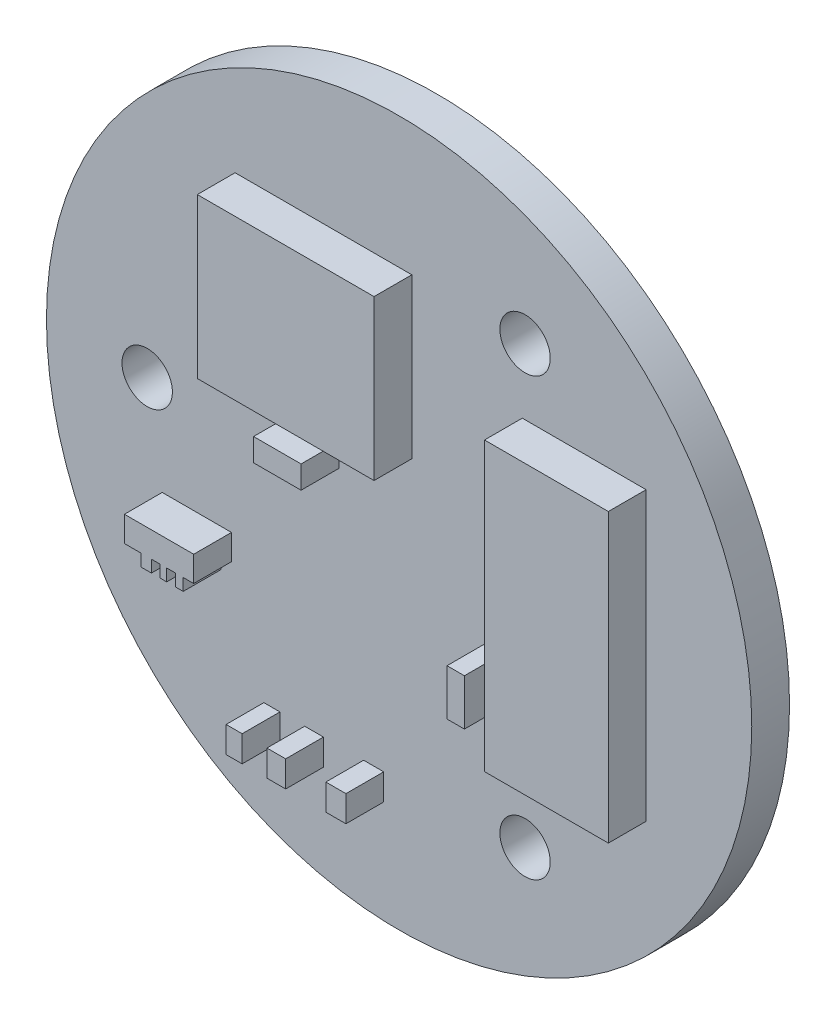
from build123d import *

# Parameters (mm, degrees)
SKETCH_1_R          = 14
EXTRUDE_1_DEPTH     = 1.5
SKETCH_2_W          = 4
SKETCH_2_H          = 5
EXTRUDE_2_DEPTH     = 1.8
SKETCH_3_R          = 1
CUT_EXTRUDE_1_DEPTH = 1.8
SKETCH_4_W          = 7.015976939
SKETCH_4_H          = 6.325009514
SKETCH_4_W_2        = 4.916498991
SKETCH_4_H_2        = 11.400962527
SKETCH_4_W_3        = 1.886872586
SKETCH_4_H_3        = 0.903572787
SKETCH_4_W_4        = 0.637816086
SKETCH_4_H_4        = 1.036451139
SKETCH_4_W_5        = 0.744118766
SKETCH_4_W_6        = 0.797270107
SKETCH_4_W_7        = 0.690967426
SKETCH_4_H_5        = 1.833721246
EXTRUDE_3_DEPTH     = 1.5


with BuildPart() as part:
    # 草图1 → 凸台-拉伸1 (new body)
    with BuildSketch(Plane.XY):
        Circle(SKETCH_1_R)
    extrude(amount=EXTRUDE_1_DEPTH)

    # 草图2 → 凸台-拉伸2 (add)
    with BuildSketch(Plane(origin=(0, 0, 0), x_dir=(-1, 0, 0), z_dir=(0, 0, -1))):
        Rectangle(SKETCH_2_W, SKETCH_2_H)
    extrude(amount=EXTRUDE_2_DEPTH)

    # 草图3 → 切除-拉伸1 (cut)
    with BuildSketch(Plane(origin=(0, 0, 0), x_dir=(-1, 0, 0), z_dir=(0, 0, -1))):
        with Locations((10, 0)):
            Circle(SKETCH_3_R)
        with Locations((-5, 8.660254038)):
            Circle(SKETCH_3_R)
        with Locations((-5, -8.660254038)):
            Circle(SKETCH_3_R)
    extrude(amount=-CUT_EXTRUDE_1_DEPTH, mode=Mode.SUBTRACT)

    # 草图4 → 凸台-拉伸3 (add)
    with BuildSketch(Plane.XY.offset(1.5)):
        Polygon((-8.105579419, -3.654154656), (-6.654300112, -3.654154656), (-6.654300112, -4.661389837), (-7.070508219, -4.661389837), (-7.070508219, -5.140659778), (-7.379939766, -5.140659778), (-7.379939766, -4.661389837), (-7.726351297, -4.661389837), (-7.726351297, -5.140659778), (-7.991211002, -5.140659778), (-7.991211002, -4.661389837), (-8.331744908, -4.661389837), (-8.331744908, -5.140659778), (-8.747953015, -5.140659778), (-8.747953015, -4.661389837), (-9.403796093, -4.661389837), (-9.403796093, -3.654154656), align=None)
        with Locations((-3.003050736, 5.620754253)):
            Rectangle(SKETCH_4_W, SKETCH_4_H)
        with Locations((7.348172818, 0.345483713)):
            Rectangle(SKETCH_4_W_2, SKETCH_4_H_2)
        with Locations((-3.335246613, 1.129465985)):
            Rectangle(SKETCH_4_W_3, SKETCH_4_H_3)
        with Locations((-5.049377343, -9.38121159)):
            Rectangle(SKETCH_4_W_4, SKETCH_4_H_4)
        with Locations((-3.375110119, -9.38121159)):
            Rectangle(SKETCH_4_W_5, SKETCH_4_H_4)
        with Locations((-1.009875468, -9.38121159)):
            Rectangle(SKETCH_4_W_6, SKETCH_4_H_4)
        with Locations((3.747169502, -3.375110119)):
            Rectangle(SKETCH_4_W_7, SKETCH_4_H_5)
    extrude(amount=EXTRUDE_3_DEPTH)


solid = part.part
